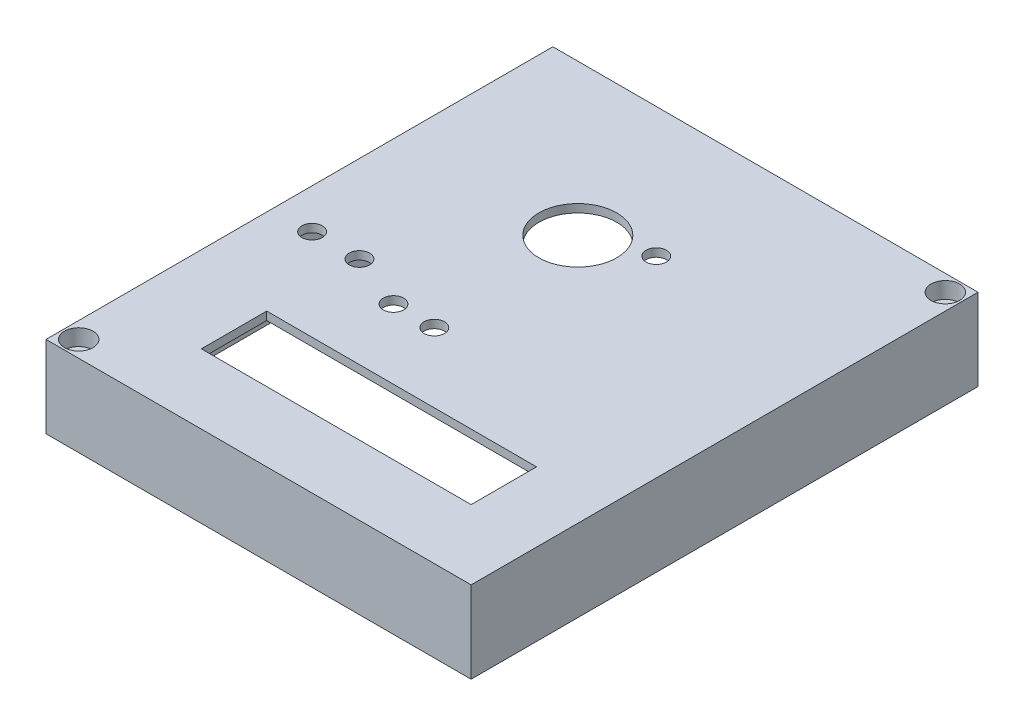
from build123d import *

# Parameters (mm, degrees)
SKETCH1_W           = 104
SKETCH1_H           = 124
BOSS_EXTRUDE1_DEPTH = 2
SKETCH4_W           = 104
SKETCH4_H           = 124
BOSS_EXTRUDE2_DEPTH = 18
CUT_EXTRUDE1_REACH  = 85.355
SKETCH5_R           = 9.525
SKETCH5_R_2         = 2.5
SKETCH5_W           = 66
SKETCH5_H           = 16
SKETCH6_R           = 2
CUT_EXTRUDE2_DEPTH  = 84.354663937
SKETCH7_R           = 3.5
CUT_EXTRUDE3_DEPTH  = 4


with BuildPart() as part:
    # Sketch1 → Boss-Extrude1 (new body)
    with BuildSketch(Plane(origin=(0, 0, 0), x_dir=(1, 0, 0), z_dir=(0, 1, 0))):
        Rectangle(SKETCH1_W, SKETCH1_H)
    extrude(amount=BOSS_EXTRUDE1_DEPTH)

    # Sketch4 → Boss-Extrude2 (add)
    with BuildSketch(Plane.XZ):
        Rectangle(SKETCH4_W, SKETCH4_H)
        Polygon((-44, 58), (-44, 54), (-48, 54), (-48, -58), (44, -58), (44, -54), (48, -54), (48, 58), align=None, mode=Mode.SUBTRACT)
    extrude(amount=BOSS_EXTRUDE2_DEPTH)

    # Sketch5 → Cut-Extrude1 (cut, up to next)
    with BuildSketch(Plane(origin=(0, 2, 0), x_dir=(1, 0, 0), z_dir=(0, 1, 0)), mode=Mode.PRIVATE) as cut_extrude1_sk1:
        with Locations((-9, 25.1)):
            Circle(SKETCH5_R)
    cut_extrude1_tool1 = extrude(cut_extrude1_sk1.sketch, amount=-CUT_EXTRUDE1_REACH, mode=Mode.PRIVATE) & part.part
    # Sketch5 → Cut-Extrude1 (cut, up to next)
    with BuildSketch(Plane(origin=(0, 2, 0), x_dir=(1, 0, 0), z_dir=(0, 1, 0)), mode=Mode.PRIVATE) as cut_extrude1_sk2:
        with Locations((-42.27, -6.63)):
            Circle(SKETCH5_R_2)
    cut_extrude1_tool2 = extrude(cut_extrude1_sk2.sketch, amount=-CUT_EXTRUDE1_REACH, mode=Mode.PRIVATE) & part.part
    # Sketch5 → Cut-Extrude1 (cut, up to next)
    with BuildSketch(Plane(origin=(0, 2, 0), x_dir=(1, 0, 0), z_dir=(0, 1, 0)), mode=Mode.PRIVATE) as cut_extrude1_sk3:
        with Locations((-30.7, -6.63)):
            Circle(SKETCH5_R_2)
    cut_extrude1_tool3 = extrude(cut_extrude1_sk3.sketch, amount=-CUT_EXTRUDE1_REACH, mode=Mode.PRIVATE) & part.part
    # Sketch5 → Cut-Extrude1 (cut, up to next)
    with BuildSketch(Plane(origin=(0, 2, 0), x_dir=(1, 0, 0), z_dir=(0, 1, 0)), mode=Mode.PRIVATE) as cut_extrude1_sk4:
        with Locations((-17, -12)):
            Circle(SKETCH5_R_2)
    cut_extrude1_tool4 = extrude(cut_extrude1_sk4.sketch, amount=-CUT_EXTRUDE1_REACH, mode=Mode.PRIVATE) & part.part
    # Sketch5 → Cut-Extrude1 (cut, up to next)
    with BuildSketch(Plane(origin=(0, 2, 0), x_dir=(1, 0, 0), z_dir=(0, 1, 0)), mode=Mode.PRIVATE) as cut_extrude1_sk5:
        with Locations((-7, -12)):
            Circle(SKETCH5_R_2)
    cut_extrude1_tool5 = extrude(cut_extrude1_sk5.sketch, amount=-CUT_EXTRUDE1_REACH, mode=Mode.PRIVATE) & part.part
    # Sketch5 → Cut-Extrude1 (cut, up to next)
    with BuildSketch(Plane(origin=(0, 2, 0), x_dir=(1, 0, 0), z_dir=(0, 1, 0)), mode=Mode.PRIVATE) as cut_extrude1_sk6:
        with Locations((5, 30.28)):
            Circle(SKETCH5_R_2)
    cut_extrude1_tool6 = extrude(cut_extrude1_sk6.sketch, amount=-CUT_EXTRUDE1_REACH, mode=Mode.PRIVATE) & part.part
    # Sketch5 → Cut-Extrude1 (cut, up to next)
    with BuildSketch(Plane(origin=(0, 2, 0), x_dir=(1, 0, 0), z_dir=(0, 1, 0)), mode=Mode.PRIVATE) as cut_extrude1_sk7:
        with Locations((2, -37)):
            Rectangle(SKETCH5_W, SKETCH5_H)
    cut_extrude1_tool7 = extrude(cut_extrude1_sk7.sketch, amount=-CUT_EXTRUDE1_REACH, mode=Mode.PRIVATE) & part.part
    add(cut_extrude1_tool1.solids().sort_by_distance((-9, 2, -25.1))[0], mode=Mode.SUBTRACT)
    add(cut_extrude1_tool2.solids().sort_by_distance((-42.27, 2, 6.63))[0], mode=Mode.SUBTRACT)
    add(cut_extrude1_tool3.solids().sort_by_distance((-30.7, 2, 6.63))[0], mode=Mode.SUBTRACT)
    add(cut_extrude1_tool4.solids().sort_by_distance((-17, 2, 12))[0], mode=Mode.SUBTRACT)
    add(cut_extrude1_tool5.solids().sort_by_distance((-7, 2, 12))[0], mode=Mode.SUBTRACT)
    add(cut_extrude1_tool6.solids().sort_by_distance((5, 2, -30.28))[0], mode=Mode.SUBTRACT)
    add(cut_extrude1_tool7.solids().sort_by_distance((2, 2, 37))[0], mode=Mode.SUBTRACT)

    # Sketch6 → Cut-Extrude2 (cut, through all)
    with BuildSketch(Plane(origin=(0, 2, 0), x_dir=(1, 0, 0), z_dir=(0, 1, 0))):
        with Locations((48, 58)):
            Circle(SKETCH6_R)
        with Locations((-48, -58)):
            Circle(SKETCH6_R)
    extrude(amount=-CUT_EXTRUDE2_DEPTH, mode=Mode.SUBTRACT)

    # Sketch7 → Cut-Extrude3 (cut)
    with BuildSketch(Plane(origin=(0, 2, 0), x_dir=(1, 0, 0), z_dir=(0, 1, 0))):
        with Locations((-48, -58)):
            Circle(SKETCH7_R)
        with Locations((48, 58)):
            Circle(SKETCH7_R)
    extrude(amount=-CUT_EXTRUDE3_DEPTH, mode=Mode.SUBTRACT)


solid = part.part
